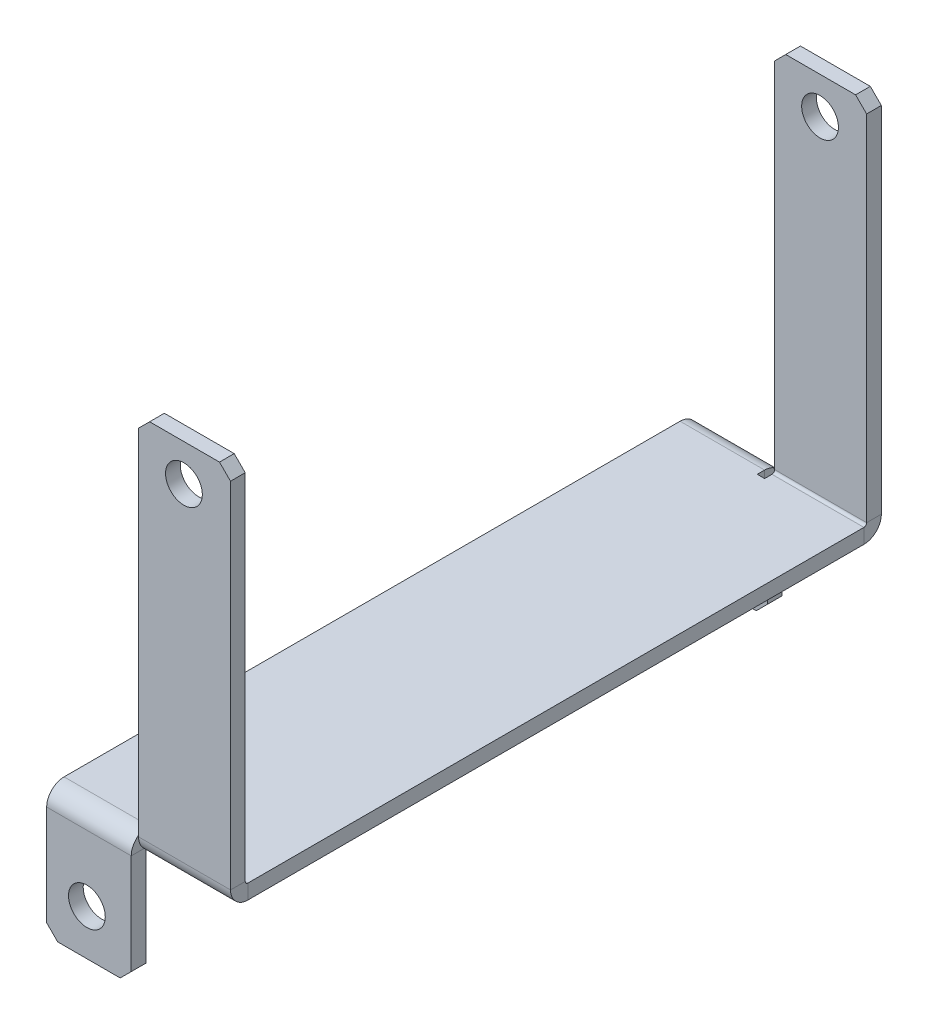
from build123d import *

# Parameters (mm, degrees)
SKETCH_1_W                        = 50
SKETCH_1_H                        = 176.98019802
SM_BASE_FLANGE_1_DEPTH            = 4
SM_EDGE_FLANGE_1_STRIP_W          = 17.4732
SM_EDGE_FLANGE_1_STRIP_H          = 4
SM_EDGE_FLANGE_1_STRIP_CUT_DEPTH  = 25
SM_EDGE_FLANGE_1_RELIEF_W         = 19.4732
SM_EDGE_FLANGE_1_RELIEF_H         = 2
SM_EDGE_FLANGE_1_RELIEF_CUT_DEPTH = 4
SM_EDGE_FLANGE_1_DEPTH            = 25
SM_EDGE_FLANGE_2_STRIP_W          = 17.4732
SM_EDGE_FLANGE_2_STRIP_H          = 4
SM_EDGE_FLANGE_2_STRIP_CUT_DEPTH  = 25
SM_EDGE_FLANGE_2_RELIEF_W         = 19.4732
SM_EDGE_FLANGE_2_RELIEF_H         = 2
SM_EDGE_FLANGE_2_RELIEF_CUT_DEPTH = 4
SM_EDGE_FLANGE_2_DEPTH            = 25
SM_EDGE_FLANGE_3_STRIP_W          = 17.4732
SM_EDGE_FLANGE_3_STRIP_H          = 4
SM_EDGE_FLANGE_3_STRIP_CUT_DEPTH  = 23
SM_EDGE_FLANGE_3_DEPTH            = 23
SM_EDGE_FLANGE_4_STRIP_W          = 17.4732
SM_EDGE_FLANGE_4_STRIP_H          = 4
SM_EDGE_FLANGE_4_STRIP_CUT_DEPTH  = 23
SM_EDGE_FLANGE_4_DEPTH            = 23
SKETCH_18_R                       = 5
CUT_EXTRUDE_1_DEPTH               = 205.809644527
SKETCH_19_R                       = 5
CUT_EXTRUDE_2_DEPTH               = 205.809644527
CHAMFER_1_SIZE                    = 3
CHAMFER_2_SIZE                    = 3


# Sheet-metal steps are written as plain solids
with BuildPart() as part:
    # Sketch 1 → 基体-法兰1 (new body)
    with BuildSketch(Plane(origin=(0, 0, 0), x_dir=(1, 0, 0), z_dir=(0, 1, 0))):
        Rectangle(SKETCH_1_W, SKETCH_1_H)
    extrude(amount=-SM_BASE_FLANGE_1_DEPTH)

    # 边线-法兰1 strip (across the edge) → 边线-法兰1 strip cut (cut)
    with BuildSketch(Plane(origin=(25, 0, -88.49009901), x_dir=(0, 0, 1), z_dir=(-1, 0, 0))):
        with Locations((-4, -2)):
            Rectangle(SM_EDGE_FLANGE_1_STRIP_W, SM_EDGE_FLANGE_1_STRIP_H)
    extrude(amount=SM_EDGE_FLANGE_1_STRIP_CUT_DEPTH, mode=Mode.SUBTRACT)

    # 边线-法兰1 relief (on the sheet) → 边线-法兰1 relief cut (cut)
    with BuildSketch(Plane(origin=(25, 0, -83.75349901), x_dir=(0, 0, 1), z_dir=(0, 1, 0))):
        with Locations((-7.7366, -26)):
            Rectangle(SM_EDGE_FLANGE_1_RELIEF_W, SM_EDGE_FLANGE_1_RELIEF_H)
    extrude(amount=-SM_EDGE_FLANGE_1_RELIEF_CUT_DEPTH, mode=Mode.SUBTRACT)

    # 边线-法兰1 section (across the edge) → 边线-法兰1 (add)
    with BuildSketch(Plane(origin=(25, 0, -88.49009901), x_dir=(0, 0, 1), z_dir=(-1, 0, 0))):
        with BuildLine():
            Line((0, 0.7366), (0, 100))
            Line((0, 100), (4, 100))
            Line((4, 100), (4, 0.7366))
            ThreePointArc((4, 0.7366), (4.215745145, 0.215745145), (4.7366, 0))
            Line((4.7366, 0), (4.7366, -4))
            ThreePointArc((4.7366, -4), (1.38731802, -2.61268198), (0, 0.7366))
        make_face()
    extrude(amount=SM_EDGE_FLANGE_1_DEPTH)

    # 边线-法兰2 strip (across the edge) → 边线-法兰2 strip cut (cut)
    with BuildSketch(Plane(origin=(0, 0, 88.49009901), x_dir=(0, 0, -1), z_dir=(1, 0, 0))):
        with Locations((-4, -2)):
            Rectangle(SM_EDGE_FLANGE_2_STRIP_W, SM_EDGE_FLANGE_2_STRIP_H)
    extrude(amount=SM_EDGE_FLANGE_2_STRIP_CUT_DEPTH, mode=Mode.SUBTRACT)

    # 边线-法兰2 relief (on the sheet) → 边线-法兰2 relief cut (cut)
    with BuildSketch(Plane(origin=(0, 0, 83.75349901), x_dir=(0, 0, -1), z_dir=(0, 1, 0))):
        with Locations((-7.7366, 1)):
            Rectangle(SM_EDGE_FLANGE_2_RELIEF_W, SM_EDGE_FLANGE_2_RELIEF_H)
    extrude(amount=-SM_EDGE_FLANGE_2_RELIEF_CUT_DEPTH, mode=Mode.SUBTRACT)

    # 边线-法兰2 section (across the edge) → 边线-法兰2 (add)
    with BuildSketch(Plane(origin=(0, 0, 88.49009901), x_dir=(0, 0, -1), z_dir=(1, 0, 0))):
        with BuildLine():
            Line((0, 0.7366), (0, 100))
            Line((0, 100), (4, 100))
            Line((4, 100), (4, 0.7366))
            ThreePointArc((4, 0.7366), (4.215745145, 0.215745145), (4.7366, 0))
            Line((4.7366, 0), (4.7366, -4))
            ThreePointArc((4.7366, -4), (1.38731802, -2.61268198), (0, 0.7366))
        make_face()
    extrude(amount=SM_EDGE_FLANGE_2_DEPTH)

    # 边线-法兰3 strip (across the edge) → 边线-法兰3 strip cut (cut)
    with BuildSketch(Plane(origin=(-2, -4, 88.49009901), x_dir=(0, 0, -1), z_dir=(-1, 0, 0))):
        with Locations((-4, -2)):
            Rectangle(SM_EDGE_FLANGE_3_STRIP_W, SM_EDGE_FLANGE_3_STRIP_H)
    extrude(amount=SM_EDGE_FLANGE_3_STRIP_CUT_DEPTH, mode=Mode.SUBTRACT)

    # 边线-法兰3 section (across the edge) → 边线-法兰3 (add)
    with BuildSketch(Plane(origin=(-2, -4, 88.49009901), x_dir=(0, 0, -1), z_dir=(-1, 0, 0))):
        with BuildLine():
            Line((0, 0.7366), (0, 31))
            Line((0, 31), (4, 31))
            Line((4, 31), (4, 0.7366))
            ThreePointArc((4, 0.7366), (4.215745145, 0.215745145), (4.7366, 0))
            Line((4.7366, 0), (4.7366, -4))
            ThreePointArc((4.7366, -4), (1.38731802, -2.61268198), (0, 0.7366))
        make_face()
    extrude(amount=SM_EDGE_FLANGE_3_DEPTH)

    # 边线-法兰4 strip (across the edge) → 边线-法兰4 strip cut (cut)
    with BuildSketch(Plane(origin=(-25, -4, -88.49009901), x_dir=(0, 0, 1), z_dir=(1, 0, 0))):
        with Locations((-4, -2)):
            Rectangle(SM_EDGE_FLANGE_4_STRIP_W, SM_EDGE_FLANGE_4_STRIP_H)
    extrude(amount=SM_EDGE_FLANGE_4_STRIP_CUT_DEPTH, mode=Mode.SUBTRACT)

    # 边线-法兰4 section (across the edge) → 边线-法兰4 (add)
    with BuildSketch(Plane(origin=(-25, -4, -88.49009901), x_dir=(0, 0, 1), z_dir=(1, 0, 0))):
        with BuildLine():
            Line((0, 0.7366), (0, 31))
            Line((0, 31), (4, 31))
            Line((4, 31), (4, 0.7366))
            ThreePointArc((4, 0.7366), (4.215745145, 0.215745145), (4.7366, 0))
            Line((4.7366, 0), (4.7366, -4))
            ThreePointArc((4.7366, -4), (1.38731802, -2.61268198), (0, 0.7366))
        make_face()
    extrude(amount=SM_EDGE_FLANGE_4_DEPTH)

    # 草图18 → 切除-拉伸1 (cut, through all)
    with BuildSketch(Plane.XY.offset(88.49009901)):
        with Locations((-14.061160699, -22.641783907)):
            Circle(SKETCH_18_R)
    extrude(amount=-CUT_EXTRUDE_1_DEPTH, mode=Mode.SUBTRACT)

    # 草图19 → 切除-拉伸2 (cut, through all)
    with BuildSketch(Plane.XY.offset(88.49009901)):
        with Locations((12.330904878, 90)):
            Circle(SKETCH_19_R)
    extrude(amount=-CUT_EXTRUDE_2_DEPTH, mode=Mode.SUBTRACT)

    # 倒角1
    chamfer_1_edges = [part.edges().sort_by_distance(p)[0] for p in [
        (-2, -35, 86.49009901),
        (-25, -35, 86.49009901),
        (-25, -35, -86.49009901),
        (-2, -35, -86.49009901),
    ]]
    chamfer(chamfer_1_edges, length=CHAMFER_1_SIZE)

    # 倒角2
    chamfer_2_edges = [part.edges().sort_by_distance(p)[0] for p in [
        (25, 100, -86.49009901),
        (0, 100, -86.49009901),
        (0, 100, 86.49009901),
        (25, 100, 86.49009901),
    ]]
    chamfer(chamfer_2_edges, length=CHAMFER_2_SIZE)


solid = part.part
